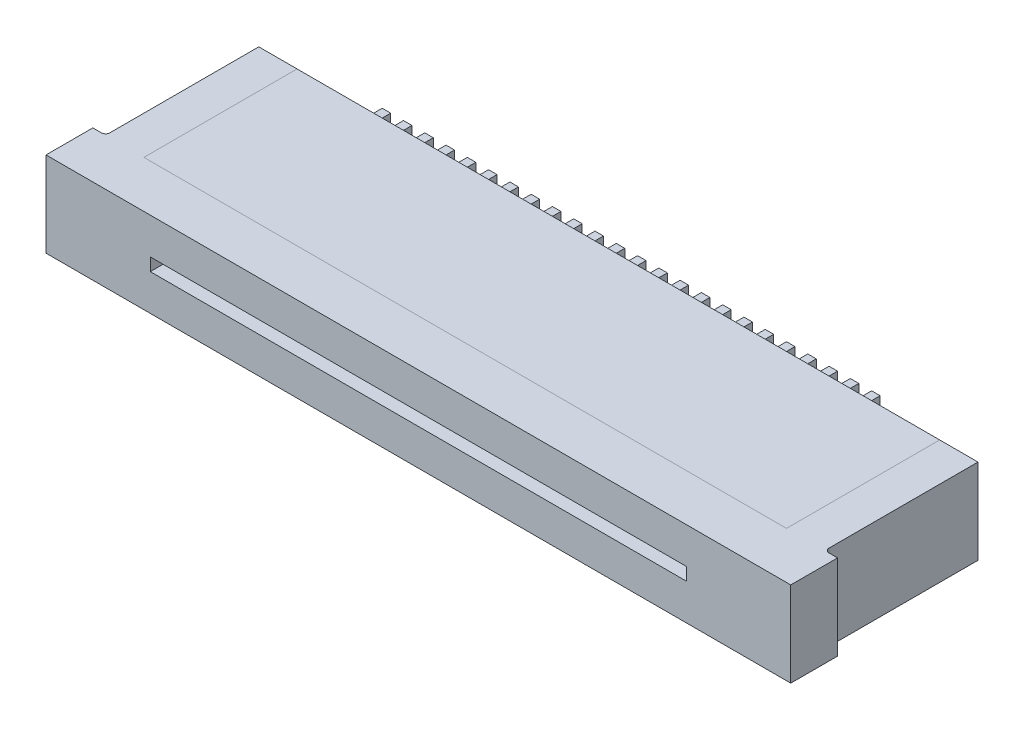
from build123d import *

# Parameters (mm, degrees)
SKETCH1_W           = 0.2
SKETCH1_H           = 0.7
BOSS_EXTRUDE1_DEPTH = 0.3
SKETCH2_W           = 0.2
SKETCH2_H           = 0.3
BOSS_EXTRUDE2_DEPTH = 2
FILLET1_R           = 0.1
LPATTERN1_COUNT     = 12
LPATTERN1_PITCH     = 0.5
LPATTERN2_COUNT     = 13
LPATTERN2_PITCH     = 0.5
BOSS_EXTRUDE3_DEPTH = 0.3
BOSS_EXTRUDE4_DEPTH = 2
SPLIT1_START        = -7.55
SPLIT1_OUTLINE_W    = 2
SPLIT1_OUTLINE_H    = 3.6
SPLIT1_DEPTH        = 15.1
SPLIT1_2_OUTLINE_W  = 2
SPLIT1_2_OUTLINE_H  = 3.6
SPLIT1_2_DEPTH      = 15.1
SKETCH6_W           = 12.6
SKETCH6_H           = 0.3
CUT_EXTRUDE1_DEPTH  = 2.8


# Read off the part's stored shape, not the designer's step: Split1
with BuildPart() as part:
    # Sketch1 → Boss-Extrude1 (new body)
    with BuildSketch(Plane(origin=(0, 0, 0), x_dir=(1, 0, 0), z_dir=(0, 1, 0))):
        with Locations((-0.25, 0.35)):
            Rectangle(SKETCH1_W, SKETCH1_H)
    extrude(amount=BOSS_EXTRUDE1_DEPTH)

    # Sketch2 → Boss-Extrude2 (add)
    with BuildSketch(Plane(origin=(0, 0, 0), x_dir=(1, 0, 0), z_dir=(0, 1, 0))):
        with Locations((-0.25, -0.15)):
            Rectangle(SKETCH2_W, SKETCH2_H)
    extrude(amount=BOSS_EXTRUDE2_DEPTH)

    # Fillet1
    fillet1_edges = [part.edges().sort_by_distance(p)[0] for p in [
        (-0.25, 0, 0.3),
        (-0.25, 0.3, 0),
        (-0.25, 0, -0.7),
        (-0.25, 0.3, -0.7),
    ]]
    fillet(fillet1_edges, radius=FILLET1_R)


with BuildPart() as lpattern1_1:
    # LPattern1: pattern copy
    add(part.part.moved(Location(Vector(-1, 0, 0) * (1 * LPATTERN1_PITCH))))


with BuildPart() as lpattern1_2:
    # LPattern1: pattern copy
    add(part.part.moved(Location(Vector(-1, 0, 0) * (2 * LPATTERN1_PITCH))))


with BuildPart() as lpattern1_3:
    # LPattern1: pattern copy
    add(part.part.moved(Location(Vector(-1, 0, 0) * (3 * LPATTERN1_PITCH))))


with BuildPart() as lpattern1_4:
    # LPattern1: pattern copy
    add(part.part.moved(Location(Vector(-1, 0, 0) * (4 * LPATTERN1_PITCH))))


with BuildPart() as lpattern1_5:
    # LPattern1: pattern copy
    add(part.part.moved(Location(Vector(-1, 0, 0) * (5 * LPATTERN1_PITCH))))


with BuildPart() as lpattern1_6:
    # LPattern1: pattern copy
    add(part.part.moved(Location(Vector(-1, 0, 0) * (6 * LPATTERN1_PITCH))))


with BuildPart() as lpattern1_7:
    # LPattern1: pattern copy
    add(part.part.moved(Location(Vector(-1, 0, 0) * (7 * LPATTERN1_PITCH))))


with BuildPart() as lpattern1_8:
    # LPattern1: pattern copy
    add(part.part.moved(Location(Vector(-1, 0, 0) * (8 * LPATTERN1_PITCH))))


with BuildPart() as lpattern1_9:
    # LPattern1: pattern copy
    add(part.part.moved(Location(Vector(-1, 0, 0) * (9 * LPATTERN1_PITCH))))


with BuildPart() as lpattern1_10:
    # LPattern1: pattern copy
    add(part.part.moved(Location(Vector(-1, 0, 0) * (10 * LPATTERN1_PITCH))))


with BuildPart() as lpattern1_11:
    # LPattern1: pattern copy
    add(part.part.moved(Location(Vector(-1, 0, 0) * (11 * LPATTERN1_PITCH))))


with BuildPart() as lpattern2_1:
    # LPattern2: pattern copy
    add(part.part.moved(Location(Vector(1, 0, 0) * (1 * LPATTERN2_PITCH))))


with BuildPart() as lpattern2_2:
    # LPattern2: pattern copy
    add(part.part.moved(Location(Vector(1, 0, 0) * (2 * LPATTERN2_PITCH))))


with BuildPart() as lpattern2_3:
    # LPattern2: pattern copy
    add(part.part.moved(Location(Vector(1, 0, 0) * (3 * LPATTERN2_PITCH))))


with BuildPart() as lpattern2_4:
    # LPattern2: pattern copy
    add(part.part.moved(Location(Vector(1, 0, 0) * (4 * LPATTERN2_PITCH))))


with BuildPart() as lpattern2_5:
    # LPattern2: pattern copy
    add(part.part.moved(Location(Vector(1, 0, 0) * (5 * LPATTERN2_PITCH))))


with BuildPart() as lpattern2_6:
    # LPattern2: pattern copy
    add(part.part.moved(Location(Vector(1, 0, 0) * (6 * LPATTERN2_PITCH))))


with BuildPart() as lpattern2_7:
    # LPattern2: pattern copy
    add(part.part.moved(Location(Vector(1, 0, 0) * (7 * LPATTERN2_PITCH))))


with BuildPart() as lpattern2_8:
    # LPattern2: pattern copy
    add(part.part.moved(Location(Vector(1, 0, 0) * (8 * LPATTERN2_PITCH))))


with BuildPart() as lpattern2_9:
    # LPattern2: pattern copy
    add(part.part.moved(Location(Vector(1, 0, 0) * (9 * LPATTERN2_PITCH))))


with BuildPart() as lpattern2_10:
    # LPattern2: pattern copy
    add(part.part.moved(Location(Vector(1, 0, 0) * (10 * LPATTERN2_PITCH))))


with BuildPart() as lpattern2_11:
    # LPattern2: pattern copy
    add(part.part.moved(Location(Vector(1, 0, 0) * (11 * LPATTERN2_PITCH))))


with BuildPart() as lpattern2_12:
    # LPattern2: pattern copy
    add(part.part.moved(Location(Vector(1, 0, 0) * (12 * LPATTERN2_PITCH))))


with BuildPart() as body_25:
    # Sketch3 → Boss-Extrude3 (new body)
    with BuildSketch(Plane(origin=(0, 0, 0), x_dir=(1, 0, 0), z_dir=(0, 1, 0))):
        Polygon((-7.5, -0.1), (-6.75, -0.1), (-6.75, -0.35), (-6.55, -0.35), (-6.55, -2.45), (-6.8, -2.45), (-7.05, -2.7), (-8.25, -2.7), (-8.25, -1.3), (-7.5, -1.3), align=None)
    extrude(amount=BOSS_EXTRUDE3_DEPTH)


with BuildPart() as body_26:
    # Mirror3: mirrored copy
    add(body_25.part.mirror(Plane(origin=(0, 0, 0), x_dir=(0, 0, 1), z_dir=(1, 0, 0))))


with BuildPart() as body_27:
    # Sketch4 → Boss-Extrude4 (new body)
    with BuildSketch(Plane(origin=(0, 0.1, 0), x_dir=(1, 0, 0), z_dir=(0, 1, 0))):
        with BuildLine():
            Line((-8.45, -0.3), (-8.45, -3.8))
            ThreePointArc((-8.45, -3.8), (-8.479289322, -3.870710678), (-8.55, -3.9))
            Line((-8.55, -3.9), (-8.75, -3.9))
            Line((-8.75, -3.9), (-8.75, -5))
            Line((-8.75, -5), (0, -5))
            Line((0, -5), (0, -0.3))
            Line((0, -0.3), (-8.45, -0.3))
        make_face()
    extrude(amount=BOSS_EXTRUDE4_DEPTH)

    # Mirror4: body 27 across plane


with BuildPart() as body_27_1:
    add(body_27.part)
    add(body_27.part.mirror(Plane(origin=(0, 0, 0), x_dir=(0, 0, 1), z_dir=(1, 0, 0))))

    # Split1 outline → Split1 (cut)
    with BuildSketch(Plane.YZ.offset(SPLIT1_START)):
        with Locations((1.1, 2.1)):
            Rectangle(SPLIT1_OUTLINE_W, SPLIT1_OUTLINE_H)
    extrude(amount=SPLIT1_DEPTH, mode=Mode.SUBTRACT)


with BuildPart() as body_28:
    # Split1 2 outline → Split1 2 (new body)
    with BuildSketch(Plane.YZ.offset(SPLIT1_START)):
        with Locations((1.1, 2.1)):
            Rectangle(SPLIT1_2_OUTLINE_W, SPLIT1_2_OUTLINE_H)
    extrude(amount=SPLIT1_2_DEPTH)


with BuildPart() as cut_extrude1_tool:
    # Sketch6 → Cut-Extrude1 (new body)
    with BuildSketch(Plane.XY.offset(5)):
        with Locations((0, 1.1)):
            Rectangle(SKETCH6_W, SKETCH6_H)
    extrude(amount=-CUT_EXTRUDE1_DEPTH)


with BuildPart() as body_27_2:
    add(body_27_1.part)

    # Cut-Extrude1: cut by cut_extrude1_tool
    add(cut_extrude1_tool.part, mode=Mode.SUBTRACT)


with BuildPart() as body_28_1:
    add(body_28.part)

    # Cut-Extrude1: cut by cut_extrude1_tool
    add(cut_extrude1_tool.part, mode=Mode.SUBTRACT)


solid = Compound([part.part, lpattern1_1.part, lpattern1_2.part, lpattern1_3.part, lpattern1_4.part, lpattern1_5.part, lpattern1_6.part, lpattern1_7.part, lpattern1_8.part, lpattern1_9.part, lpattern1_10.part, lpattern1_11.part, lpattern2_1.part, lpattern2_2.part, lpattern2_3.part, lpattern2_4.part, lpattern2_5.part, lpattern2_6.part, lpattern2_7.part, lpattern2_8.part, lpattern2_9.part, lpattern2_10.part, lpattern2_11.part, lpattern2_12.part, body_25.part, body_26.part, body_27_2.part, body_28_1.part])
